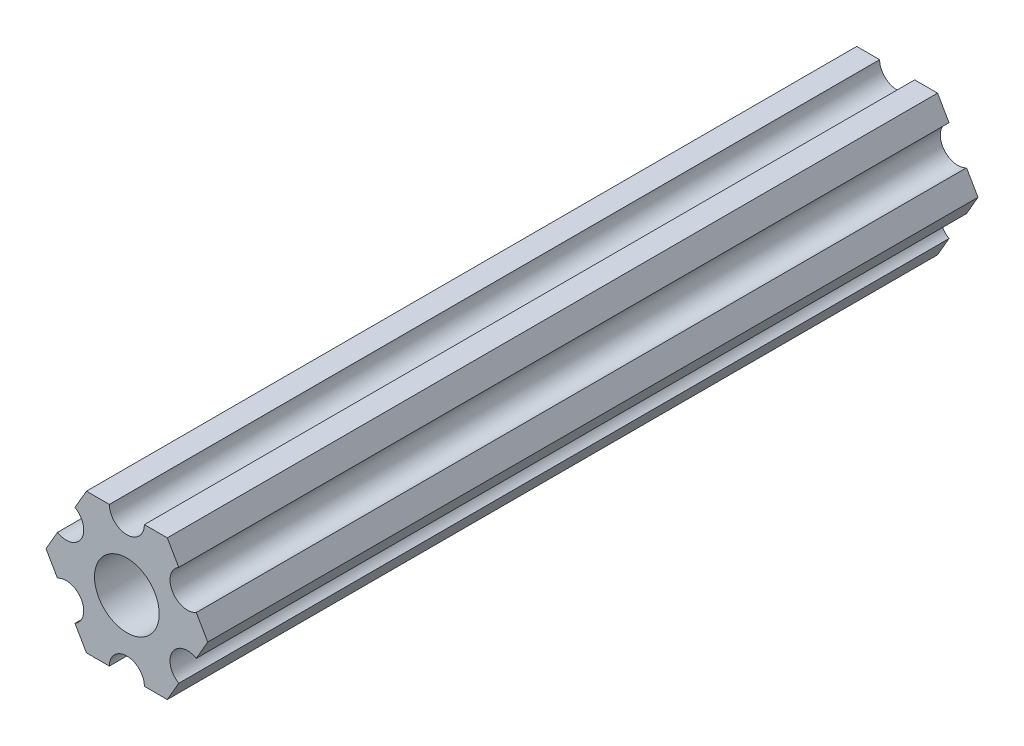
from build123d import *

# Parameters (mm, degrees)
SKETCH1_R           = 2.9337
BOSS_EXTRUDE1_DEPTH = 69.85


with BuildPart() as part:
    # Sketch1 → Boss-Extrude1 (new body)
    with BuildSketch(Plane.XY):
        with BuildLine():
            Line((-4.70551159, -4.549815043), (-3.666174521, -6.349999904))
            Line((-3.666174521, -6.349999904), (-1.587501154, -6.349999904))
            ThreePointArc((-1.587501154, -6.349999904), (-3.85e-07, -4.762499134), (1.587501154, -6.349999904))
            Line((1.587501154, -6.349999904), (3.666173825, -6.349999904))
            Line((3.666173825, -6.349999904), (4.705510929, -4.549815232))
            ThreePointArc((4.705510929, -4.549815232), (4.124445601, -2.381249904), (6.293010929, -1.800184575))
            Line((6.293010929, -1.800184575), (7.332348034, 9.6e-08))
            Line((7.332348034, 9.6e-08), (6.293011178, 1.800184715))
            ThreePointArc((6.293011178, 1.800184715), (4.124445902, 2.381250241), (4.705511428, 4.549815516))
            Line((4.705511428, 4.549815516), (3.666174521, 6.350000222))
            Line((3.666174521, 6.350000222), (1.587498846, 6.350000222))
            ThreePointArc((1.587498846, 6.350000222), (3.85e-07, 4.762501761), (-1.587498846, 6.350000222))
            Line((-1.587498846, 6.350000222), (-3.666173825, 6.350000222))
            Line((-3.666173825, 6.350000222), (-4.705511038, 4.549815614))
            ThreePointArc((-4.705511038, 4.549815614), (-4.124445841, 2.38125025), (-6.293011205, 1.800185053))
            Line((-6.293011205, 1.800185053), (-7.332348419, 4.44e-07))
            Line((-7.332348419, 4.44e-07), (-6.293011423, -1.80018429))
            ThreePointArc((-6.293011423, -1.80018429), (-4.12444613, -2.38124975), (-4.70551159, -4.549815043))
        make_face()
        Circle(SKETCH1_R, mode=Mode.SUBTRACT)
    extrude(amount=-BOSS_EXTRUDE1_DEPTH)


solid = part.part
